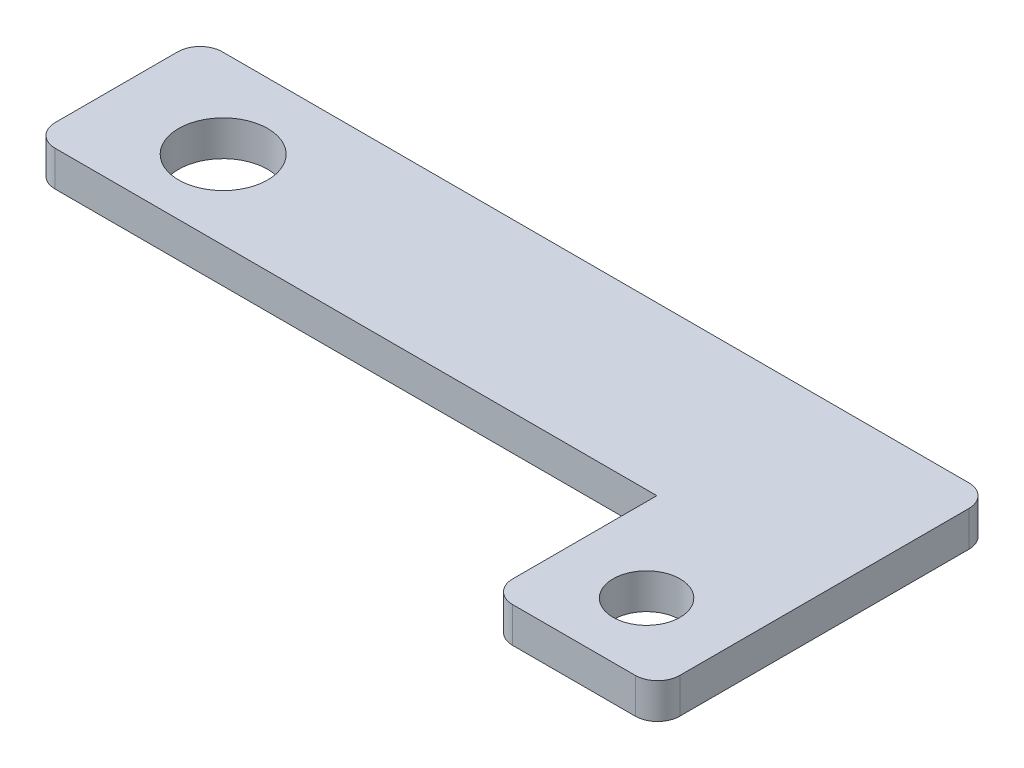
from build123d import *

# Parameters (mm, degrees)
SKETCH2_R          = 4
SKETCH2_R_2        = 3
BASE_FLANGE1_DEPTH = 3.175
FILLET1_R          = 2


# Sheet-metal steps are written as plain solids
with BuildPart() as part:
    # Sketch2 → Base-Flange1 (new body)
    with BuildSketch(Plane.XZ.offset(-47.844717124)):
        Polygon((208.087093798, -67.18067292), (208.087093798, -37.24408426), (193.087093798, -37.24408426), (193.087093798, -52.18067292), (137.087093798, -52.18067292), (137.087093798, -67.18067292), align=None)
        with Locations(Location((147.087093798, -59.257788189, 0), (0, 0, 270))):
            Circle(SKETCH2_R, mode=Mode.SUBTRACT)
        with Locations(Location((200.587093798, -43.757788189, 0), (0, 0, 270))):
            Circle(SKETCH2_R_2, mode=Mode.SUBTRACT)
    extrude(amount=BASE_FLANGE1_DEPTH)

    # Fillet1
    fillet1_edges = [part.edges().sort_by_distance(p)[0] for p in [
        (193.087093798, 46.257217124, -37.24408426),
        (208.087093798, 46.257217124, -37.24408426),
        (208.087093798, 46.257217124, -67.18067292),
        (137.087093798, 46.257217124, -67.18067292),
        (137.087093798, 46.257217124, -52.18067292),
    ]]
    fillet(fillet1_edges, radius=FILLET1_R)


solid = part.part
